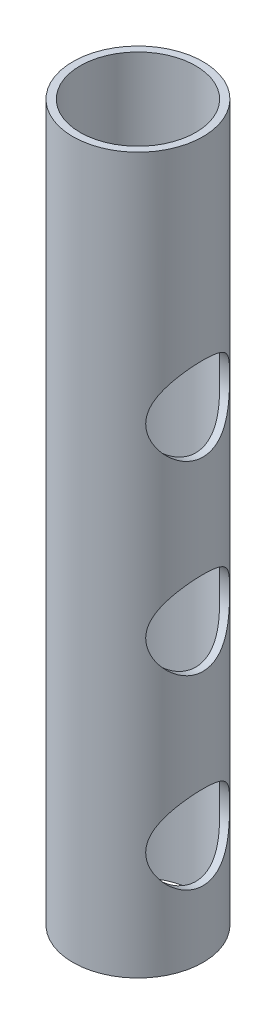
from build123d import *

# Parameters (mm, degrees)
SKETCH1_R           = 17.875
SKETCH1_R_2         = 15.875
BOSS_EXTRUDE1_DEPTH = 196.5
SKETCH2_R           = 11.53
CUT_EXTRUDE1_DEPTH  = 199.119361118


with BuildPart() as part:
    # Sketch1 → Boss-Extrude1 (new body)
    with BuildSketch(Plane(origin=(0, 0, 0), x_dir=(1, 0, 0), z_dir=(0, 1, 0))):
        Circle(SKETCH1_R)
        Circle(SKETCH1_R_2, mode=Mode.SUBTRACT)
    extrude(amount=BOSS_EXTRUDE1_DEPTH)

    # Sketch2 → Cut-Extrude1 (cut, through all)
    with BuildSketch(Plane(origin=(0, 0, 0), x_dir=(0, 0, -1), z_dir=(1, 0, 0))):
        with Locations((0, 131.8)):
            Circle(SKETCH2_R)
        with Locations((0, 80.8)):
            Circle(SKETCH2_R)
        with Locations((0, 29.8)):
            Circle(SKETCH2_R)
    extrude(amount=CUT_EXTRUDE1_DEPTH, mode=Mode.SUBTRACT)


solid = part.part
